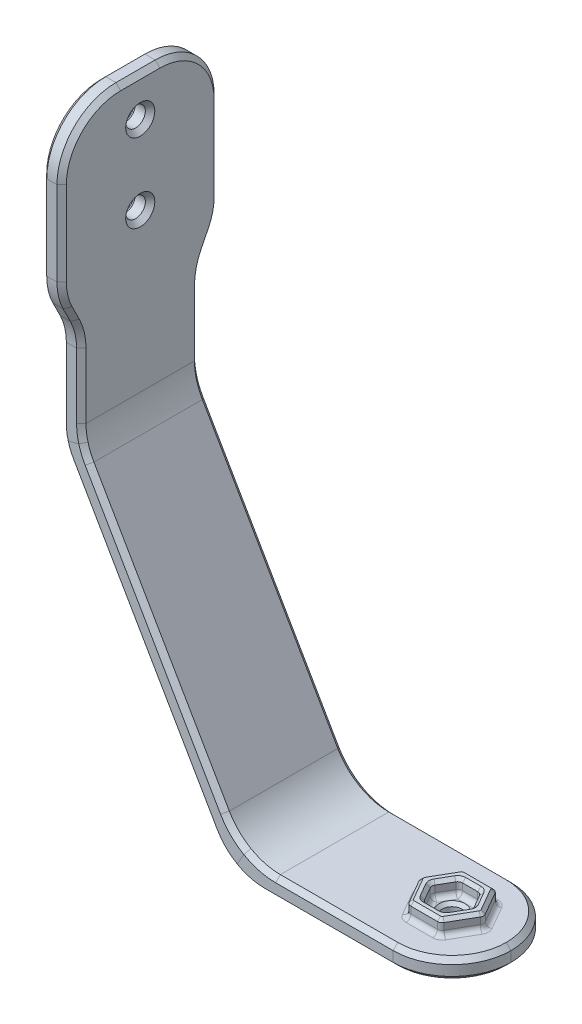
from build123d import *

# Parameters (mm, degrees)
SKETCH2_W               = 3.175
SKETCH2_H               = 19.05
BOSS_EXTRUDE1_DEPTH     = 1.5875
CUT_EXTRUDE1_DEPTH      = 114.998495911
CUT_EXTRUDE1_DEPTH_BACK = 114.998495911
SKETCH8_R               = 1.5875
CUT_EXTRUDE2_DEPTH      = 112.362478624
CUT_EXTRUDE2_DEPTH_BACK = 112.362478624
SKETCH9_R               = 1.5875
BOSS_EXTRUDE2_DEPTH     = 2.38125
FILLET1_R               = 9.525
FILLET2_R               = 0.79375
CHAMFER1_SIZE           = 0.762
CHAMFER2_SIZE           = 0.508


with BuildPart() as part:
    # Sweep1: sweep along a path in Sketch1
    with BuildLine(Plane.XY) as sweep1_path:
        Line((0, 0), (0, -47.5145354))
        Line((0, -47.5145354), (26.579763018, -93.5520354))
        Line((26.579763018, -93.5520354), (61.504763018, -93.5520354))
    # Sketch2 → Sweep1 (sweep)
    with BuildSketch(Plane(origin=(0, 0, 0), x_dir=(1, 0, 0), z_dir=(0, 1, 0))):
        Rectangle(SKETCH2_W, SKETCH2_H)
    sweep(path=sweep1_path.line, transition=Transition.RIGHT)

    # Sketch7 → Boss-Extrude1 (add, symmetric)
    with BuildSketch(Plane(origin=(0, 0, 0), x_dir=(0, 0, -1), z_dir=(1, 0, 0))):
        Polygon((-12.7, -25.4), (-9.525, -31.75), (9.525, -31.75), (12.7, -25.4), (12.7, 0), (-12.7, 0), align=None)
    extrude(amount=BOSS_EXTRUDE1_DEPTH, both=True)

    # Sketch8 → Cut-Extrude1 (cut, two sides: drawn at the far end of the back side and taken through both)
    with BuildSketch(Plane(origin=(0, 0, 0), x_dir=(0, 0, -1), z_dir=(1, 0, 0)).offset(-CUT_EXTRUDE1_DEPTH_BACK)):
        with Locations((0, -6.35)):
            Circle(SKETCH8_R)
        with Locations((0, -19.05)):
            Circle(SKETCH8_R)
    extrude(amount=CUT_EXTRUDE1_DEPTH + CUT_EXTRUDE1_DEPTH_BACK, mode=Mode.SUBTRACT)

    # Sketch9 → Cut-Extrude2 (cut, two sides: drawn at the far end of the back side and taken through both)
    with BuildSketch(Plane(origin=(0, -91.9645354, 0), x_dir=(1, 0, 0), z_dir=(0, 1, 0)).offset(-CUT_EXTRUDE2_DEPTH_BACK)):
        with Locations(Location((51.979763018, 0, 0), (0, 0, 180))):
            Circle(SKETCH9_R)
    extrude(amount=CUT_EXTRUDE2_DEPTH + CUT_EXTRUDE2_DEPTH_BACK, mode=Mode.SUBTRACT)

    # Sketch10 → Boss-Extrude2 (add)
    with BuildSketch(Plane(origin=(0, -91.9645354, 0), x_dir=(1, 0, 0), z_dir=(0, 1, 0))):
        Polygon((54.582746706, 4.5085), (49.376779329, 4.5085), (46.773795641, 0), (49.376779329, -4.5085), (54.582746706, -4.5085), (57.185730395, 0), align=None)
        Polygon((53.666203154, 2.921), (50.293322882, 2.921), (48.606882745, 0), (50.293322882, -2.921), (53.666203154, -2.921), (55.35264329, 0), align=None, mode=Mode.SUBTRACT)
    extrude(amount=BOSS_EXTRUDE2_DEPTH)

    # Fillet1
    fillet1_edges = [part.edges().sort_by_distance(p)[0] for p in [
        (0, -31.75, -9.525),
        (0, -25.4, -12.7),
        (0, -31.75, 9.525),
        (0, -25.4, 12.7),
        (0, 0, -12.7),
        (0, 0, 12.7),
        (61.504763018, -93.5520354, -9.525),
        (61.504763018, -93.5520354, 9.525),
        (1.5875, -47.089166057, 0),
        (-1.5875, -47.939904743, 0),
        (25.663219465, -95.1395354, 0),
        (27.49630657, -91.9645354, 0),
    ]]
    fillet(fillet1_edges, radius=FILLET1_R - 0.0001)  # a hair under: the kernel refuses the full size

    # Fillet2
    fillet2_edges = [part.edges().sort_by_distance(p)[0] for p in [
        (49.376779329, -90.7739104, -4.5085),
        (48.075287485, -91.9645354, 2.25425),
        (46.773795641, -90.7739104, 0),
        (51.979763018, -91.9645354, 4.5085),
        (49.376779329, -90.7739104, 4.5085),
        (55.884238551, -91.9645354, 2.25425),
        (54.582746706, -90.7739104, 4.5085),
        (53.666203154, -90.7739104, -2.921),
        (50.293322882, -90.7739104, -2.921),
        (48.606882745, -90.7739104, 0),
        (50.293322882, -90.7739104, 2.921),
        (53.666203154, -90.7739104, 2.921),
        (55.35264329, -90.7739104, 0),
        (54.509423222, -91.9645354, -1.4605),
        (51.979763018, -91.9645354, -2.921),
        (49.450102813, -91.9645354, -1.4605),
        (49.450102813, -91.9645354, 1.4605),
        (51.979763018, -91.9645354, 2.921),
        (54.509423222, -91.9645354, 1.4605),
        (55.884238551, -91.9645354, -2.25425),
        (57.185730395, -90.7739104, 0),
        (51.979763018, -91.9645354, -4.5085),
        (54.582746706, -90.7739104, -4.5085),
        (48.075287485, -91.9645354, -2.25425),
    ]]
    fillet(fillet2_edges, radius=FILLET2_R)

    # Chamfer1
    chamfer1_edges = [part.edges().sort_by_distance(p)[0] for p in [
        (13.805149706, -68.250756097, -9.525),
        (13.805149706, -68.250756097, 9.525),
        (1.5875, 0, 0),
        (1.5875, -16.338188061, 12.7),
        (1.5875, -28.575, 11.1125),
        (1.5875, -39.267750336, 9.525),
        (1.5875, -39.267750336, -9.525),
        (1.5875, -28.575, -11.1125),
        (1.5875, -16.338188061, -12.7),
        (1.5875, -2.78977862, 9.91022138),
        (1.5875, -2.78977862, -9.91022138),
        (1.5875, -25.339849714, 12.4451993),
        (1.5875, -25.339849714, -12.4451993),
        (11.301106154, -70.26362544, 9.525),
        (11.301106154, -70.26362544, -9.525),
        (26.399973044, -93.863440769, -9.525),
        (-1.262946903, -47.852941003, -9.525),
        (-1.5875, -39.693119679, -9.525),
        (-1.262946903, -47.852941003, -9.525),
        (-1.5875, 0, 0),
        (-1.5875, -16.338188061, -12.7),
        (-1.5875, -28.575, -11.1125),
        (-1.5875, -39.693119679, 9.525),
        (-1.5875, -28.575, 11.1125),
        (-1.5875, -16.338188061, 12.7),
        (-1.5875, -2.78977862, 9.91022138),
        (-1.5875, -2.78977862, -9.91022138),
        (-1.5875, -25.339849714, 12.4451993),
        (-1.5875, -25.339849714, -12.4451993),
        (-1.262946903, -47.852941003, 9.525),
        (26.399973044, -93.863440769, 9.525),
        (-1.262946903, -47.852941003, 9.525),
        (41.571143031, -95.1395354, -9.525),
        (41.571143031, -95.1395354, 9.525),
        (58.714984398, -95.1395354, 6.73522138),
        (58.714984398, -95.1395354, -6.73522138),
        (42.487686583, -91.9645354, -9.525),
        (26.399973044, -93.863440769, -9.525),
        (42.487686583, -91.9645354, 9.525),
        (26.399973044, -93.863440769, 9.525),
        (58.714984398, -91.9645354, 6.73522138),
        (58.714984398, -91.9645354, -6.73522138),
        (1.912053097, -47.002202317, 9.525),
        (1.912053097, -47.002202317, 9.525),
        (1.912053097, -47.002202317, -9.525),
        (1.912053097, -47.002202317, -9.525),
        (28.233060149, -90.688440769, 9.525),
        (28.233060149, -90.688440769, 9.525),
        (28.233060149, -90.688440769, -9.525),
        (28.233060149, -90.688440769, -9.525),
        (-1.5875, -31.810150286, -9.7798007),
        (1.5875, -31.810150286, -9.7798007),
        (-1.5875, -31.810150286, 9.7798007),
        (1.5875, -31.810150286, 9.7798007),
        (-1.5875, -6.35, 1.5875),
        (1.5875, -6.35, 1.5875),
        (-1.5875, -19.05, 1.5875),
        (1.5875, -19.05, 1.5875),
    ]]
    chamfer(chamfer1_edges, length=CHAMFER1_SIZE)

    # Chamfer2
    chamfer2_edges = [part.edges().sort_by_distance(p)[0] for p in [
        (55.884238551, -89.5832854, -2.25425),
        (55.884238551, -89.5832854, 2.25425),
        (51.979763018, -89.5832854, -4.5085),
        (48.075287485, -89.5832854, -2.25425),
        (48.075287485, -89.5832854, 2.25425),
        (51.979763018, -89.5832854, 4.5085),
        (51.979763018, -89.5832854, -2.921),
        (54.509423222, -89.5832854, -1.4605),
        (54.509423222, -89.5832854, 1.4605),
        (51.979763018, -89.5832854, 2.921),
        (49.450102813, -89.5832854, 1.4605),
        (49.450102813, -89.5832854, -1.4605),
        (49.438176105, -89.5832854, 4.402157664),
        (54.52134993, -89.5832854, -4.402157664),
        (49.438176105, -89.5832854, -4.402157664),
        (46.896589193, -89.5832854, 0),
        (54.52134993, -89.5832854, 4.402157664),
        (57.062936843, -89.5832854, 0),
        (48.729676298, -89.5832854, 0),
        (50.354719658, -89.5832854, 2.814657664),
        (53.604806378, -89.5832854, 2.814657664),
        (55.229849738, -89.5832854, 0),
        (53.604806378, -89.5832854, -2.814657664),
        (50.354719658, -89.5832854, -2.814657664),
        (53.567263018, -95.1395354, 0),
        (53.567263018, -91.9645354, 0),
    ]]
    chamfer(chamfer2_edges, length=CHAMFER2_SIZE)


solid = part.part
